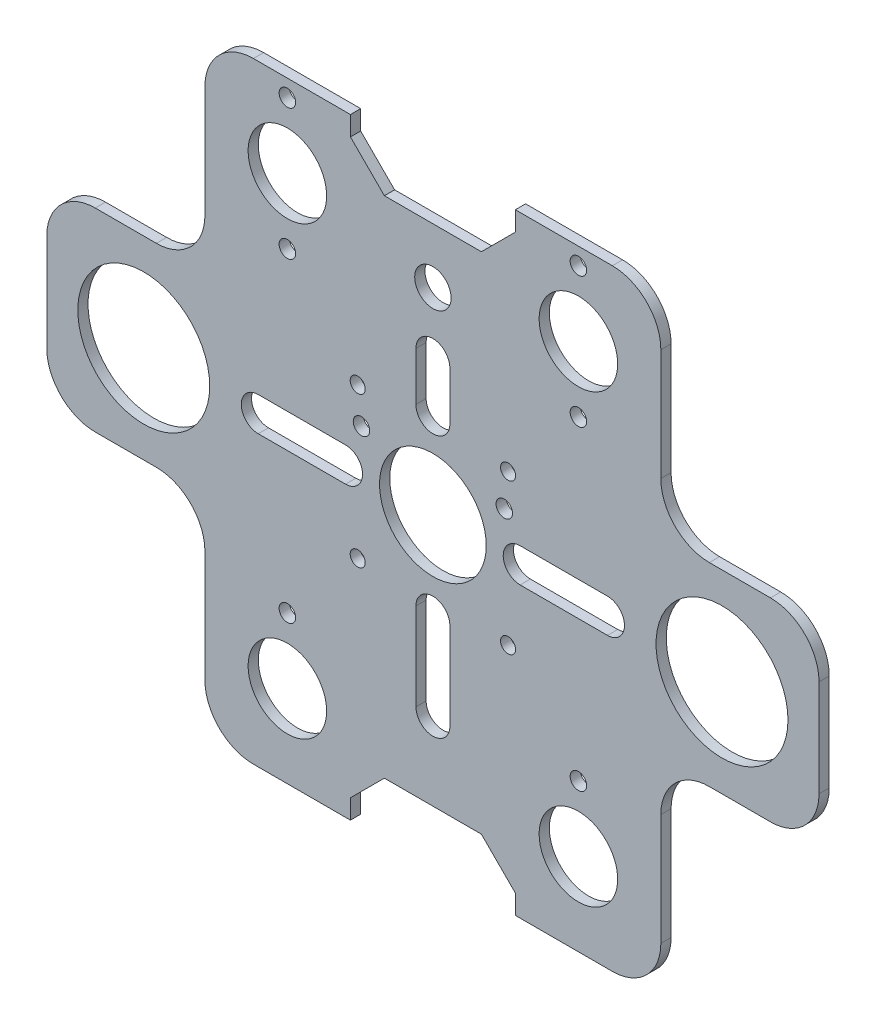
from build123d import *

# Parameters (mm, degrees)
CROQUIS1_W              = 159.22
CROQUIS1_H              = 92
SALIENTE_EXTRUIR1_DEPTH = 2.11
CROQUIS2_R              = 13.6
CORTAR_EXTRUIR1_DEPTH   = 2.11
CROQUIS3_R              = 11
CROQUIS3_R_2            = 1.55
CORTAR_EXTRUIR2_DEPTH   = 2.11
CROQUIS4_W              = 49.61
CROQUIS4_H              = 26
CORTAR_EXTRUIR3_DEPTH   = 2.11
SALIENTE_EXTRUIR2_DEPTH = 2.11
REDONDEO2_R             = 10
CROQUIS5_R              = 8.1
CORTAR_EXTRUIR4_DEPTH   = 2.11
CHAFL_N1_SIZE           = 7
CROQUIS8_R              = 1.7
CORTAR_EXTRUIR5_DEPTH   = 2.11
MATRIZC1_OUTLINE_R      = 1.7
MATRIZC1_DEPTH          = 2.11
CROQUIS9_R              = 1.7
CORTAR_EXTRUIR6_DEPTH   = 2.11
CROQUIS10_R             = 3.75
CORTAR_EXTRUIR7_DEPTH   = 2.11


# Read off the part's stored shape, not the designer's step: MatrizC1
with BuildPart() as part:
    # Croquis1 → Saliente-Extruir1 (new body)
    with BuildSketch(Plane.XY):
        Rectangle(CROQUIS1_W, CROQUIS1_H)
    extrude(amount=SALIENTE_EXTRUIR1_DEPTH)

    # Croquis2 → Cortar-Extruir1 (cut)
    with BuildSketch(Plane.XY.offset(2.11)):
        with Locations((59.61, 0)):
            Circle(CROQUIS2_R)
        with Locations((-59.61, 0)):
            Circle(CROQUIS2_R)
    extrude(amount=-CORTAR_EXTRUIR1_DEPTH, mode=Mode.SUBTRACT)

    # Croquis3 → Cortar-Extruir2 (cut)
    with BuildSketch(Plane.XY.offset(2.11)):
        Circle(CROQUIS3_R)
        with Locations((15.5, 15.5)):
            Circle(CROQUIS3_R_2)
        with Locations((15.5, -15.5)):
            Circle(CROQUIS3_R_2)
        with Locations((-15.5, -15.5)):
            Circle(CROQUIS3_R_2)
        with Locations((-15.5, 15.5)):
            Circle(CROQUIS3_R_2)
    extrude(amount=-CORTAR_EXTRUIR2_DEPTH, mode=Mode.SUBTRACT)

    # Croquis4 → Cortar-Extruir3 (cut)
    with BuildSketch(Plane(origin=(0, 0, 0), x_dir=(-1, 0, 0), z_dir=(0, 0, -1))):
        with Locations((-54.805, 33)):
            Rectangle(CROQUIS4_W, CROQUIS4_H)
        with Locations((-54.805, -33)):
            Rectangle(CROQUIS4_W, CROQUIS4_H)
        with Locations((54.805, -33)):
            Rectangle(CROQUIS4_W, CROQUIS4_H)
        with Locations((54.805, 33)):
            Rectangle(CROQUIS4_W, CROQUIS4_H)
    extrude(amount=-CORTAR_EXTRUIR3_DEPTH, mode=Mode.SUBTRACT)

    # Croquis6 → Saliente-Extruir2 (add)
    with BuildSketch(Plane(origin=(0, 0, 0), x_dir=(-1, 0, 0), z_dir=(0, 0, -1))):
        Polygon((-47, 20), (-30, 20), (-30, 46), (30, 46), (30, 20), (47, 20), (47, 63), (17, 63), (17, 52), (-17, 52), (-17, 63), (-47, 63), align=None)
        Polygon((-30, -46), (30, -46), (30, -20), (47, -20), (47, -63), (17, -63), (17, -52), (-17, -52), (-17, -63), (-47, -63), (-47, -20), (-30, -20), align=None)
    extrude(amount=-SALIENTE_EXTRUIR2_DEPTH)

    # Redondeo2
    redondeo2_edges = [part.edges().sort_by_distance(p)[0] for p in [
        (47, 20, 1.055),
        (47, 63, 1.055),
        (-47, 63, 1.055),
        (-47, 20, 1.055),
        (-47, -20, 1.055),
        (-47, -63, 1.055),
        (47, -63, 1.055),
        (47, -20, 1.055),
        (-79.61, 20, 1.055),
        (-79.61, -20, 1.055),
        (79.61, -20, 1.055),
        (79.61, 20, 1.055),
    ]]
    fillet(redondeo2_edges, radius=REDONDEO2_R)

    # Croquis5 → Cortar-Extruir4 (cut)
    with BuildSketch(Plane(origin=(0, 0, 0), x_dir=(-1, 0, 0), z_dir=(0, 0, -1))):
        with Locations((-30, 46)):
            Circle(CROQUIS5_R)
        with Locations((30, 46)):
            Circle(CROQUIS5_R)
        with Locations((30, -46)):
            Circle(CROQUIS5_R)
        with Locations((-30, -46)):
            Circle(CROQUIS5_R)
        with BuildLine():
            Line((-3.5, -36), (-3.5, -18))
            ThreePointArc((-3.5, -18), (0, -14.5), (3.5, -18))
            Line((3.5, -18), (3.5, -36))
            ThreePointArc((3.5, -36), (0, -39.5), (-3.5, -36))
        make_face()
        with BuildLine():
            Line((-36, 3.5), (-18, 3.5))
            ThreePointArc((-18, 3.5), (-14.5, 0), (-18, -3.5))
            Line((-18, -3.5), (-36, -3.5))
            ThreePointArc((-36, -3.5), (-39.5, 0), (-36, 3.5))
        make_face()
        with BuildLine():
            Line((3.5, 28), (3.5, 18))
            ThreePointArc((3.5, 18), (0, 14.5), (-3.5, 18))
            Line((-3.5, 18), (-3.5, 28))
            ThreePointArc((-3.5, 28), (0, 31.5), (3.5, 28))
        make_face()
        with BuildLine():
            Line((36, -3.5), (18, -3.5))
            ThreePointArc((18, -3.5), (14.5, 0), (18, 3.5))
            Line((18, 3.5), (36, 3.5))
            ThreePointArc((36, 3.5), (39.5, 0), (36, -3.5))
        make_face()
    extrude(amount=-CORTAR_EXTRUIR4_DEPTH, mode=Mode.SUBTRACT)

    # Chaflán1
    chafl_n1_edges = [part.edges().sort_by_distance(p)[0] for p in [
        (17, 52, 1.055),
        (-17, 52, 1.055),
        (-17, -52, 1.055),
        (17, -52, 1.055),
    ]]
    chamfer(chafl_n1_edges, length=CHAFL_N1_SIZE)

    # Croquis8 → Cortar-Extruir5 (cut)
    with BuildSketch(Plane(origin=(0, 0, 0), x_dir=(-1, 0, 0), z_dir=(0, 0, -1))):
        with Locations((-14.722431864, 8.5)):
            Circle(CROQUIS8_R)
    extrude(amount=-CORTAR_EXTRUIR5_DEPTH, mode=Mode.SUBTRACT)

    # MatrizC1 outline → MatrizC1 (cut)
    with BuildSketch(Plane.XY):
        with Locations((-14.722431864, 8.5)):
            Circle(MATRIZC1_OUTLINE_R)
    extrude(amount=MATRIZC1_DEPTH, mode=Mode.SUBTRACT)

    # Croquis9 → Cortar-Extruir6 (cut)
    with BuildSketch(Plane(origin=(0, 0, 0), x_dir=(-1, 0, 0), z_dir=(0, 0, -1))):
        with Locations((-30, 32.5)):
            Circle(CROQUIS9_R)
        with Locations((30, 32.5)):
            Circle(CROQUIS9_R)
        with Locations((-30, 59.5)):
            Circle(CROQUIS9_R)
        with Locations((30, -32.5)):
            Circle(CROQUIS9_R)
        with Locations((-30, -32.5)):
            Circle(CROQUIS9_R)
        with Locations((30, 59.5)):
            Circle(CROQUIS9_R)
    extrude(amount=-CORTAR_EXTRUIR6_DEPTH, mode=Mode.SUBTRACT)

    # Croquis10 → Cortar-Extruir7 (cut)
    with BuildSketch(Plane(origin=(0, 0, 0), x_dir=(-1, 0, 0), z_dir=(0, 0, -1))):
        with Locations((0, 40.6)):
            Circle(CROQUIS10_R)
    extrude(amount=-CORTAR_EXTRUIR7_DEPTH, mode=Mode.SUBTRACT)


solid = part.part
